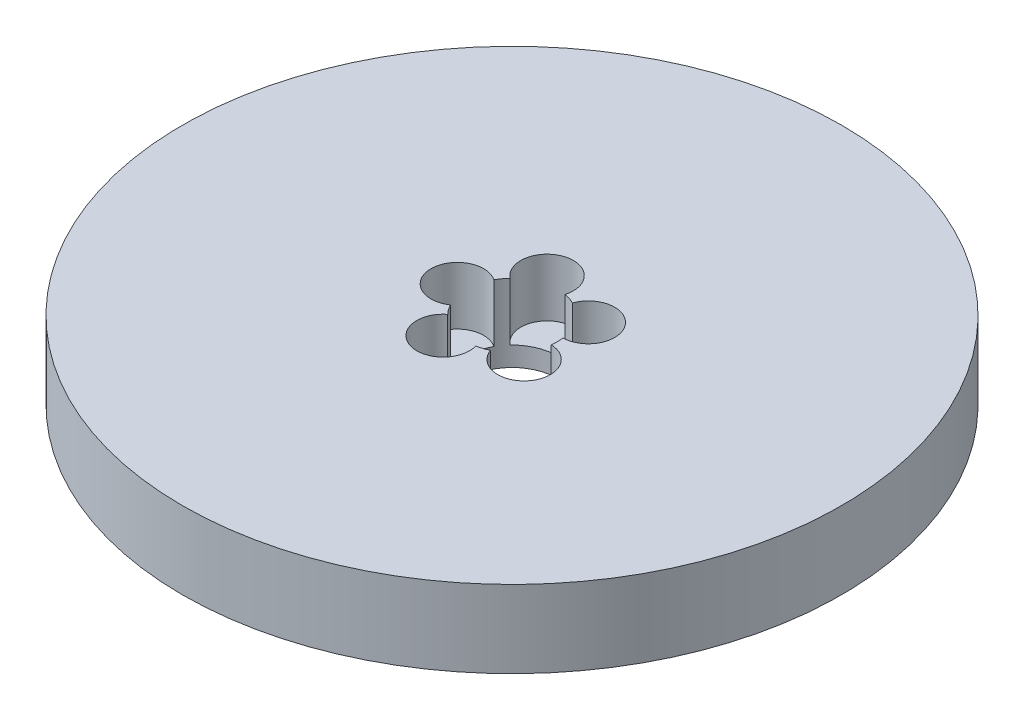
from build123d import *

# Parameters (mm, degrees)
SKETCH1_R           = 72.5
BOSS_EXTRUDE1_DEPTH = 17
SKETCH2_R           = 10
CUT_EXTRUDE1_DEPTH  = 104.930265082
SKETCH3_R           = 5.787383494
CUT_EXTRUDE2_DEPTH  = 12.71339911
CIRPATTERN1_COUNT   = 5


with BuildPart() as part:
    # Sketch1 → Boss-Extrude1 (new body)
    with BuildSketch(Plane(origin=(0, 0, 0), x_dir=(1, 0, 0), z_dir=(0, 1, 0))):
        Circle(SKETCH1_R)
    extrude(amount=BOSS_EXTRUDE1_DEPTH)

    # Sketch2 → Cut-Extrude1 (cut, through all)
    with BuildSketch(Plane(origin=(0, 0, 0), x_dir=(1, 0, 0), z_dir=(0, 1, 0))):
        Circle(SKETCH2_R)
    extrude(amount=CUT_EXTRUDE1_DEPTH, mode=Mode.SUBTRACT)

    # Sketch3 → Cut-Extrude2 (cut)
    with BuildSketch(Plane(origin=(0, 17, 0), x_dir=(1, 0, 0), z_dir=(0, 1, 0))):
        with Locations((-12.024401956, 0)):
            Circle(SKETCH3_R)
    cut_extrude2 = extrude(amount=-CUT_EXTRUDE2_DEPTH, mode=Mode.SUBTRACT)

    # CirPattern1: Cut-Extrude2 ×5 about axis
    cirpattern1_axis = Axis((0, 0, 0), (0, 1, 0))
    for i in range(1, CIRPATTERN1_COUNT):
        add(cut_extrude2.rotate(cirpattern1_axis, i * 360 / CIRPATTERN1_COUNT), mode=Mode.SUBTRACT)


solid = part.part
